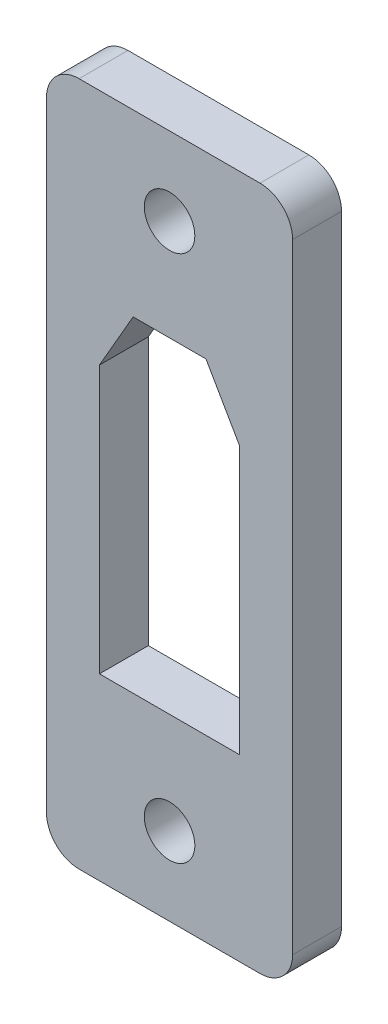
from build123d import *

# Parameters (mm, degrees)
SKETCH1_W           = 15.1
SKETCH1_H           = 42
SKETCH1_R           = 1.55
BOSS_EXTRUDE1_DEPTH = 3
FILLET1_R           = 2
CUT_EXTRUDE1_DEPTH  = 23.516716013


with BuildPart() as part:
    # Sketch1 → Boss-Extrude1 (new body)
    with BuildSketch(Plane.XY):
        Rectangle(SKETCH1_W, SKETCH1_H)
        with Locations((0, 16.2)):
            Circle(SKETCH1_R, mode=Mode.SUBTRACT)
        with Locations((0, -16.2)):
            Circle(SKETCH1_R, mode=Mode.SUBTRACT)
    extrude(amount=BOSS_EXTRUDE1_DEPTH)

    # Fillet1
    fillet1_edges = [part.edges().sort_by_distance(p)[0] for p in [
        (-7.55, -21, 1.5),
        (7.55, -21, 1.5),
        (-7.55, 21, 1.5),
        (7.55, 21, 1.5),
    ]]
    fillet(fillet1_edges, radius=FILLET1_R)

    # Sketch2 → Cut-Extrude1 (cut, through all)
    with BuildSketch(Plane.XY.offset(3)):
        Polygon((-4.3, 6.410799303), (-4.3, -10), (4.3, -10), (4.3, 6.410799303), (2.234727484, 10), (-2.234727484, 10), align=None)
    extrude(amount=-CUT_EXTRUDE1_DEPTH, mode=Mode.SUBTRACT)


solid = part.part
